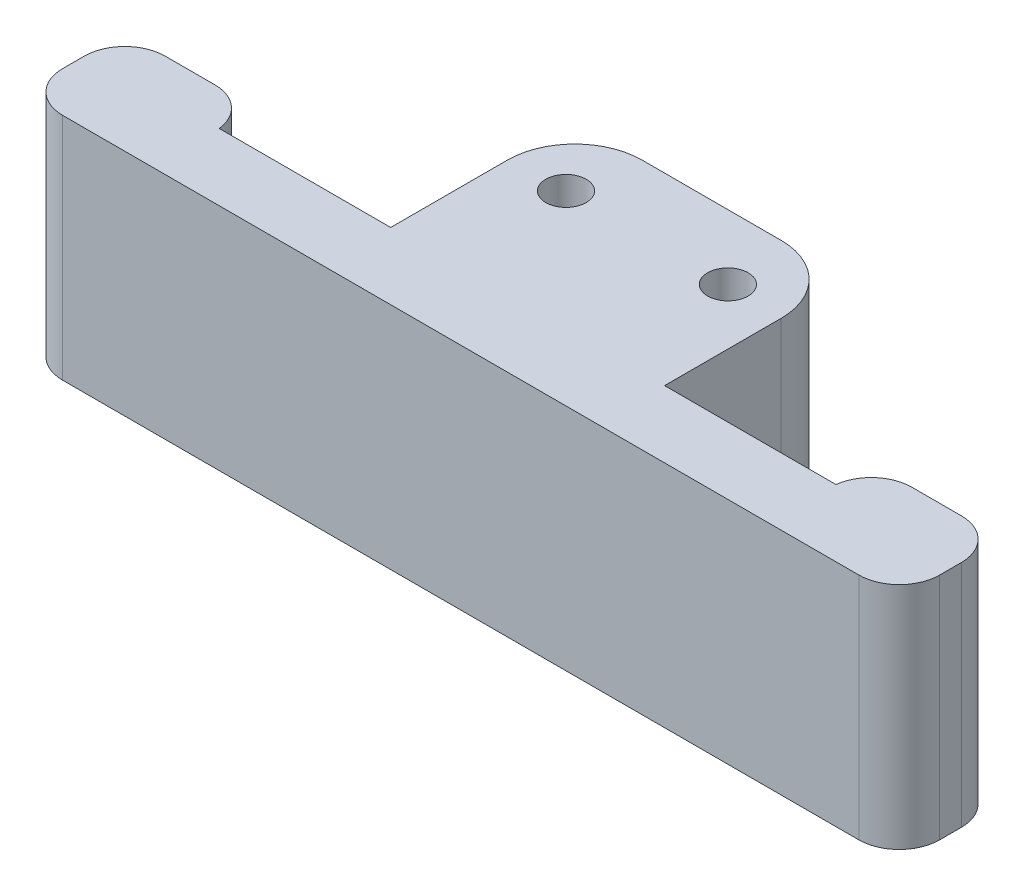
from build123d import *

# Parameters (mm, degrees)
SKETCH1_R           = 1.5
BOSS_EXTRUDE1_DEPTH = 17
SKETCH2_R           = 1
CUT_EXTRUDE1_DEPTH  = 12
FILLET2_R           = 5
FILLET3_R           = 3


with BuildPart() as part:
    # Sketch1 → Boss-Extrude1 (new body)
    with BuildSketch(Plane(origin=(0, 0, 0), x_dir=(1, 0, 0), z_dir=(0, 1, 0))):
        Polygon((-32.5, -13.8), (32.5, -13.8), (32.5, -6.2), (22.85, -6.2), (22.85, -8.84), (10.15, -8.84), (10.15, -6.2), (10.15, 4.8), (-10.15, 4.8), (-10.15, -8.84), (-22.85, -8.84), (-22.85, -6.2), (-32.5, -6.2), align=None)
        with Locations(Location((-6, 0, 0), (0, 0, 270))):
            Circle(SKETCH1_R, mode=Mode.SUBTRACT)
        with Locations(Location((6, 0, 0), (0, 0, 270))):
            Circle(SKETCH1_R, mode=Mode.SUBTRACT)
    extrude(amount=BOSS_EXTRUDE1_DEPTH)

    # Sketch2 → Cut-Extrude1 (cut)
    with BuildSketch(Plane.XZ):
        with Locations(Location((-3.1, 10, 0), (0, 0, 270))):
            Circle(SKETCH2_R)
        with Locations(Location((-29.9, 10, 0), (0, 0, 270))):
            Circle(SKETCH2_R)
        with Locations(Location((3.1, 10, 0), (0, 0, 270))):
            Circle(SKETCH2_R)
        with Locations(Location((29.9, 10, 0), (0, 0, 270))):
            Circle(SKETCH2_R)
    extrude(amount=-CUT_EXTRUDE1_DEPTH, mode=Mode.SUBTRACT)

    # Fillet2
    fillet2_edges = [part.edges().sort_by_distance(p)[0] for p in [
        (-10.15, 8.5, -4.8),
        (10.15, 8.5, -4.8),
    ]]
    fillet(fillet2_edges, radius=FILLET2_R)

    # Fillet3
    # the kernel refuses this fillet: 3 mm, written as the material it takes off along each edge
    with BuildSketch(Plane(origin=(-32.5, -7.5, 13.8), x_dir=(0, 0, -1), z_dir=(0, 1, 0)), Plane(origin=(32.5, -7.5, 13.8), x_dir=(-1, 0, 0), z_dir=(0, 1, 0)), Plane(origin=(32.5, -7.5, 6.2), x_dir=(0, 0, 1), z_dir=(0, 1, 0)), Plane(origin=(-32.5, -7.5, 6.2), x_dir=(1, 0, 0), z_dir=(0, 1, 0))) as fillet3_piece_1:
        with BuildLine():
            CenterArc((FILLET3_R, -FILLET3_R), FILLET3_R, 90, 90)
            Line((0, -FILLET3_R), (-FILLET3_R * 0.02, -FILLET3_R))
            Line((-FILLET3_R * 0.02, -FILLET3_R), (-FILLET3_R * 0.02, FILLET3_R * 0.02))
            Line((-FILLET3_R * 0.02, FILLET3_R * 0.02), (FILLET3_R, FILLET3_R * 0.02))
            Line((FILLET3_R, FILLET3_R * 0.02), (FILLET3_R, 0))
        make_face()
    extrude(amount=32, mode=Mode.SUBTRACT)
    with BuildSketch(Plane(origin=(22.85, -7.445804188, 6.2), x_dir=(0, 0, 1), z_dir=(0, 1, 0))) as fillet3_piece_2:
        with BuildLine():
            CenterArc((3, 2.978321675), FILLET3_R, 180, 83.107897421)
            Line((0, 2.978321675), (-0.06, 2.978321675))
            Line((-0.06, 2.978321675), (-0.06, 0))
            Line((-0.06, 0), (0, -0.06))
            ThreePointArc((0, -0.06), (1.32, -0.06), (2.6328, -0.059566434))
            Line((2.6328, -0.059566434), (2.64, 0))
        make_face()
    extrude(amount=31.891608375, mode=Mode.SUBTRACT)
    with BuildSketch(Plane(origin=(-22.85, -7.445804188, 6.2), x_dir=(0, 0, 1), z_dir=(0, 1, 0))) as fillet3_piece_3:
        with BuildLine():
            CenterArc((3, -2.978321675), FILLET3_R, 96.892102579, 83.107897421)
            Line((0, -2.978321675), (-0.06, -2.978321675))
            Line((-0.06, -2.978321675), (-0.06, 0))
            Line((-0.06, 0), (0, 0.06))
            ThreePointArc((0, 0.06), (1.32, 0.06), (2.6328, 0.059566434))
            Line((2.6328, 0.059566434), (2.64, 0))
        make_face()
    extrude(amount=31.891608375, mode=Mode.SUBTRACT)


solid = part.part
